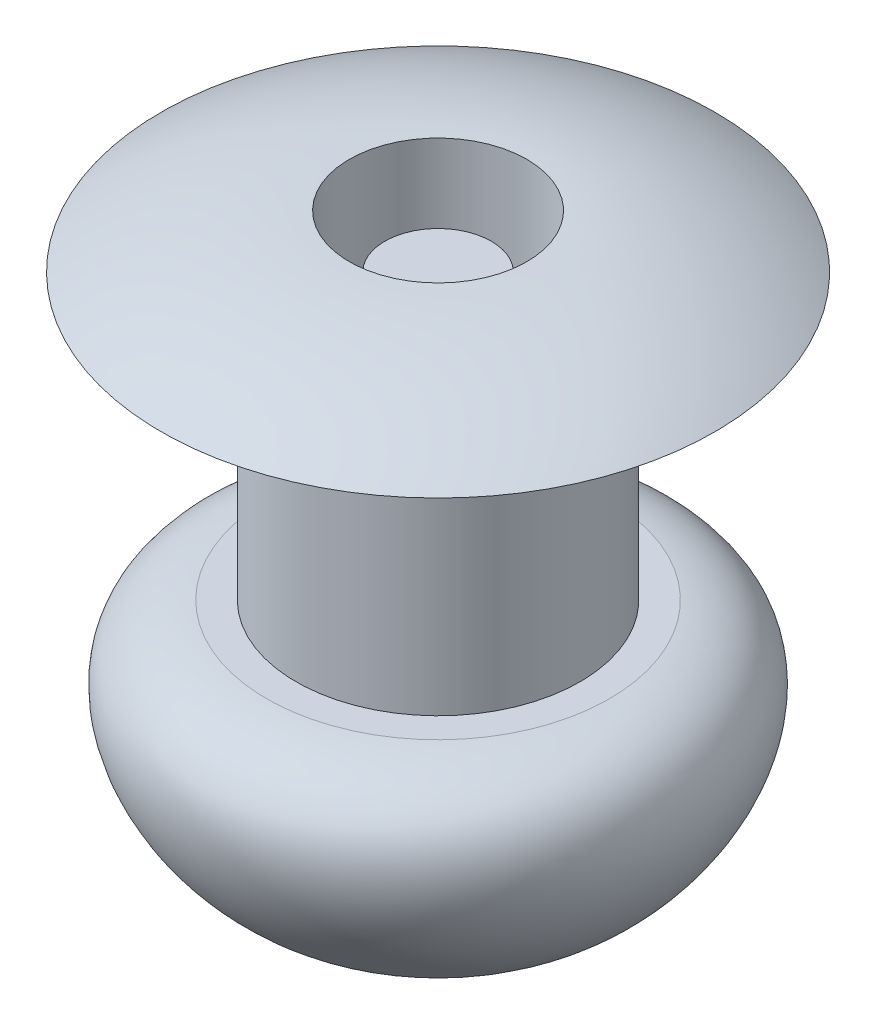
from build123d import *


with BuildPart() as part:
    # Szkic1 → Obrót1 (revolve)
    with BuildSketch(Plane(origin=(0, 0, 0), x_dir=(0, 0, -1), z_dir=(1, 0, 0))):
        with BuildLine():
            Line((0, 0), (0, -4))
            Line((0, -4), (0, -5.5))
            add(Edge.make_bspline(
                [(-0.956030427, -5.378190671), (-0.520263876, -5.5), (0, -5.5)],
                knots=[4.134444875, 4.134444875, 4.134444875, 4.71238898, 4.71238898, 4.71238898], degree=2, weights=[1, 0.958537313, 1]))
            add(Edge.make_bspline(
                [(-2.413891755, -4), (-3.858559437, -4.163296686), (-3.558358928, -6.322980362), (-0.971318098, -7.871940016), (-0.341145137, -5.79203191), (-0.956030427, -5.378190671)],
                knots=[0, 0, 0, 0, 0.454219308, 0.705200672, 1, 1, 1, 1], degree=3))
            Line((-2.413891755, -4), (-2, -4))
            Line((-2, -4), (-2, 0))
            Line((-2, 0), (-3.9, 0))
            ThreePointArc((-3.9, 0), (-2.627043935, 0.558888572), (-1.25, 0.75))
            Line((-1.25, 0.75), (-1.25, -4))
            Line((-1.25, -4), (-0.75, -4))
            Line((-0.75, -4), (-0.75, 0))
            Line((-0.75, 0), (0, 0))
        make_face()
    revolve(axis=Axis((0, 0, 0), (0, 1, 0)))


solid = part.part
